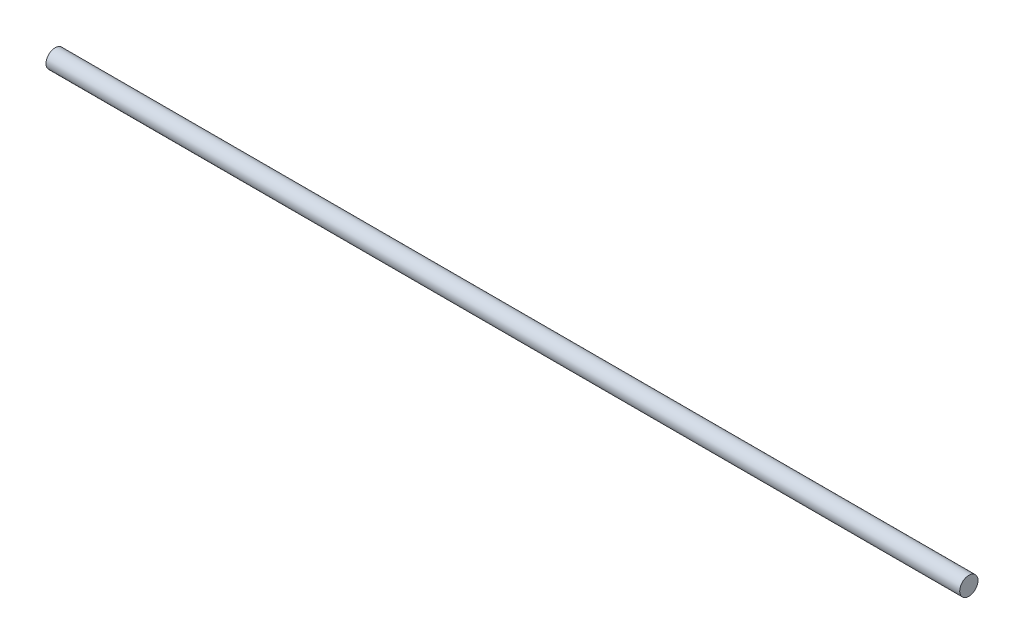
from build123d import *

# Parameters (mm, degrees)
SKETCH1_R           = 1
BOSS_EXTRUDE1_DEPTH = 50


with BuildPart() as part:
    # Sketch1 → Boss-Extrude1 (new, symmetric)
    with BuildSketch(Plane.YZ):
        Circle(SKETCH1_R)
    extrude(amount=BOSS_EXTRUDE1_DEPTH, both=True)


solid = part.part
